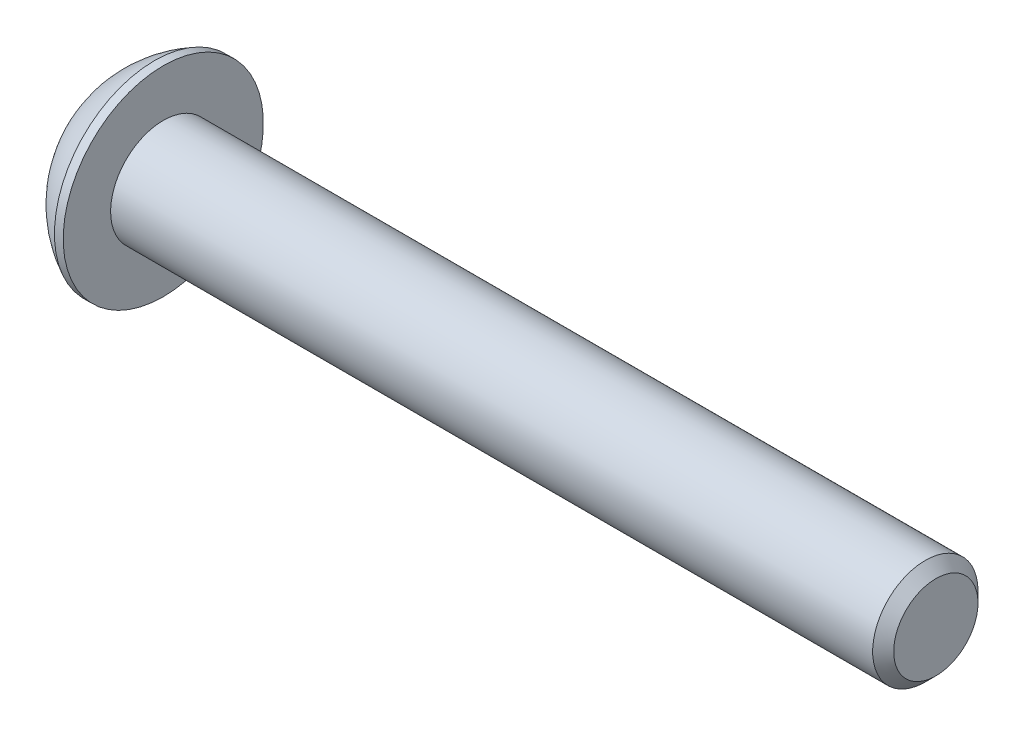
from build123d import *

# Parameters (mm, degrees)
SKETCH2_R           = 1.5
BOSS_EXTRUDE1_DEPTH = 22
CHAMFER1_SIZE       = 0.3
CUT_EXTRUDE1_DEPTH  = 1.2
SKETCH8_R           = 1.204700538
CUT_EXTRUDE2_DEPTH  = 1
CUT_EXTRUDE2_DRAFT  = -45


with BuildPart() as part:
    # Sketch2 → Boss-Extrude1 (new body)
    with BuildSketch(Plane(origin=(0, 0, 0), x_dir=(0, 0, -1), z_dir=(1, 0, 0))):
        Circle(SKETCH2_R)
    extrude(amount=-BOSS_EXTRUDE1_DEPTH)

    # Chamfer1
    chamfer1_edges = [part.edges().sort_by_distance(p)[0] for p in [
        (0, 0, 1.5),
    ]]
    chamfer(chamfer1_edges, length=CHAMFER1_SIZE)

    # Sketch6 → Revolve1 (revolve)
    with BuildSketch(Plane.XY):
        with BuildLine():
            Line((-23.65, 0), (-23.65, 1.5))
            ThreePointArc((-23.65, 1.5), (-23.055944823, 2.284868705), (-22.25, 2.85))
            Line((-22.25, 2.85), (-22, 2.85))
            Line((-22, 2.85), (-22, 0))
            Line((-22, 0), (-23.65, 0))
        make_face()
    revolve(axis=Axis((-22, 0, 0), (1, 0, 0)))

    # Sketch7 → Cut-Extrude1 (cut)
    with BuildSketch(Plane.ZY.offset(23.65)):
        Polygon((0, 1.154700538), (-1, 0.577350269), (-1, -0.577350269), (0, -1.154700538), (1, -0.577350269), (1, 0.577350269), align=None)
    extrude(amount=-CUT_EXTRUDE1_DEPTH, mode=Mode.SUBTRACT)


with BuildPart() as cut_extrude2_tool:
    # Sketch8 → Cut-Extrude2 (with draft: the straight prism first)
    with BuildSketch(Plane.ZY.offset(23.65)):
        Circle(SKETCH8_R)
    extrude(amount=-CUT_EXTRUDE2_DEPTH)
    # Cut-Extrude2: the draft: its side faces are tilted about the plane it starts from
    cut_extrude2_sides = [cut_extrude2_tool.faces().sort_by_distance(p)[0] for p in [
        (-23.15, 0, -1.204700538),
    ]]
    draft(cut_extrude2_sides, Plane.ZY.offset(23.65), CUT_EXTRUDE2_DRAFT)


with BuildPart() as part_1:
    add(part.part)

    # Cut-Extrude2: cut by cut_extrude2_tool
    add(cut_extrude2_tool.part, mode=Mode.SUBTRACT)


solid = part_1.part
